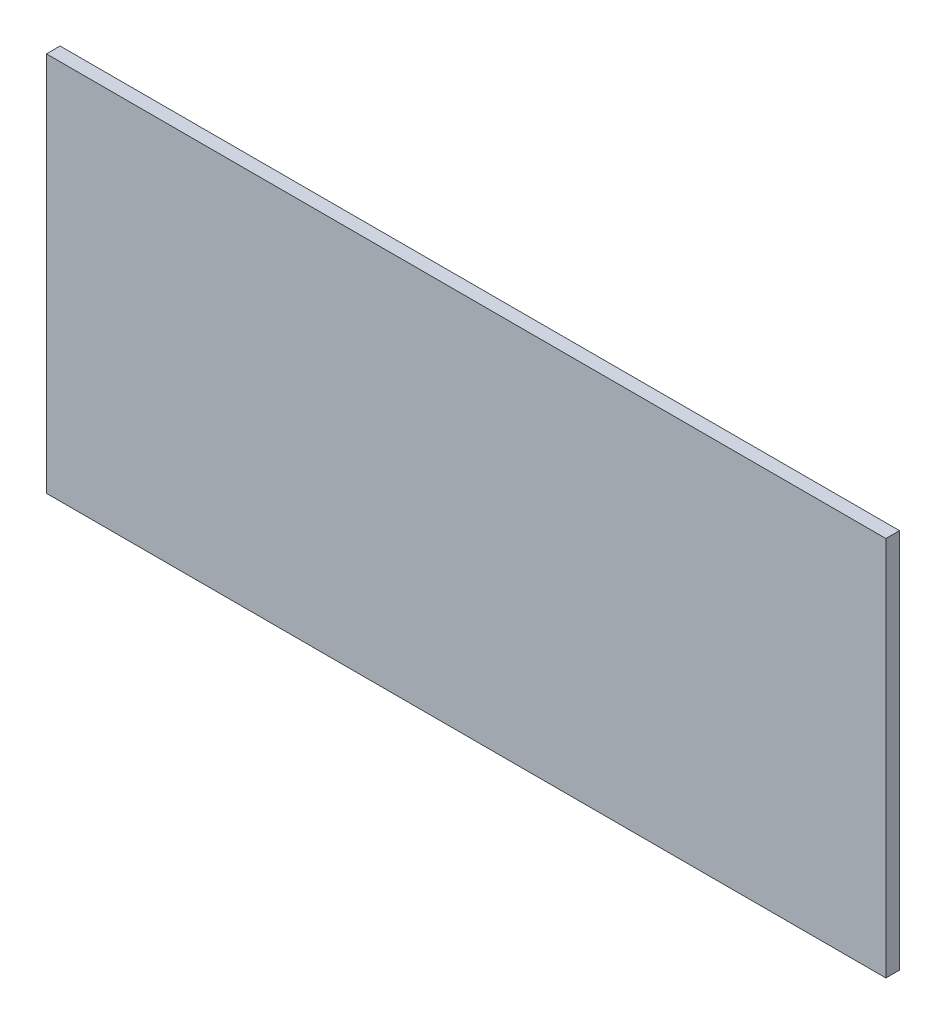
from build123d import *

# Parameters (mm, degrees)
SKETCH1_W           = 184.414327478
SKETCH1_H           = 83.61431582
BOSS_EXTRUDE1_DEPTH = 3


with BuildPart() as part:
    # Sketch1 → Boss-Extrude1 (new body)
    with BuildSketch(Plane.XY):
        with Locations((112.494062572, 5.79284209)):
            Rectangle(SKETCH1_W, SKETCH1_H)
    extrude(amount=BOSS_EXTRUDE1_DEPTH)


solid = part.part
